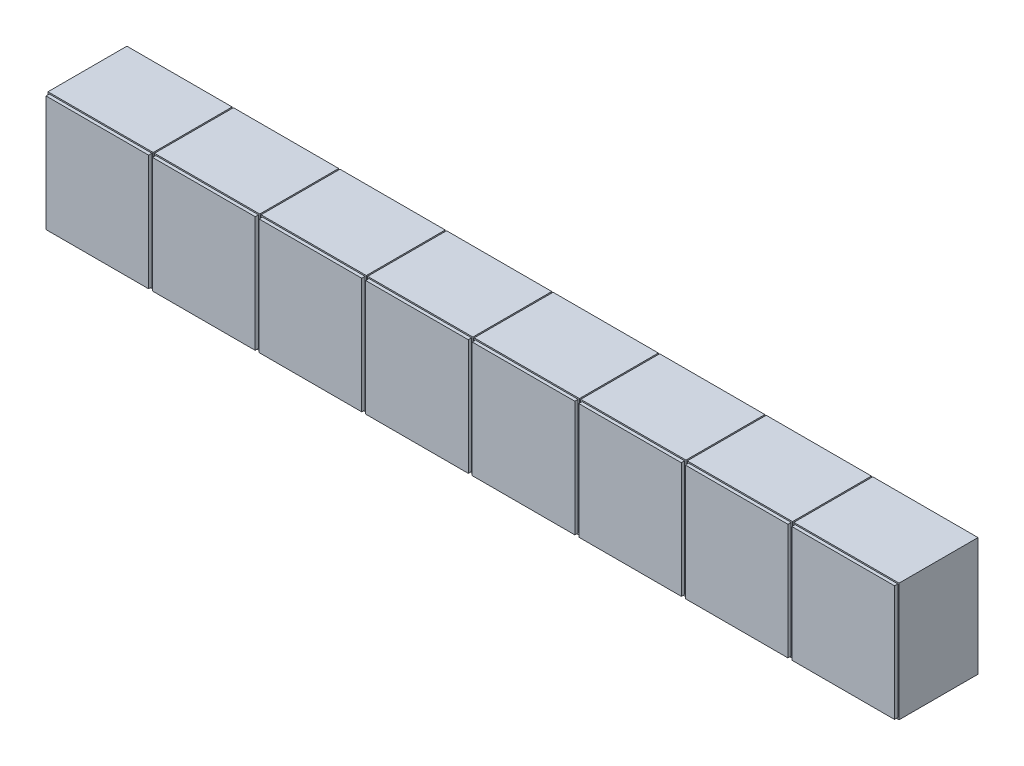
from build123d import *

# Parameters (mm, degrees)
SKETCH5_W           = 800
SKETCH5_H           = 900
BOSS_EXTRUDE7_DEPTH = 600
SKETCH6_W           = 760
SKETCH6_H           = 860
CUT_EXTRUDE3_DEPTH  = 100
SKETCH10_W          = 780
SKETCH10_H          = 880
BOSS_EXTRUDE8_DEPTH = 25


with BuildPart() as part:
    # Sketch5 → Boss-Extrude7 (new body)
    with BuildSketch(Plane.XY):
        with Locations((70.705071793, 182.298806907)):
            Rectangle(SKETCH5_W, SKETCH5_H)
    extrude(amount=BOSS_EXTRUDE7_DEPTH)

    # Sketch6 → Cut-Extrude3 (cut)
    with BuildSketch(Plane.XY.offset(600)):
        with Locations((70.705071793, 182.298806907)):
            Rectangle(SKETCH6_W, SKETCH6_H)
    extrude(amount=-CUT_EXTRUDE3_DEPTH, mode=Mode.SUBTRACT)

    # Sketch10 → Boss-Extrude8 (add)
    with BuildSketch(Plane.XY.offset(600)):
        with Locations((70.705071793, 182.298806907)):
            Rectangle(SKETCH10_W, SKETCH10_H)
    extrude(amount=BOSS_EXTRUDE8_DEPTH)


with BuildPart() as body_2:
    # Body-Move/Copy2: read off the stored shape, not the designer's step
    # Body-Move/Copy2: copy of part
    add(part.part.moved(Location((5670, 0, 0))))


with BuildPart() as body_3:
    # Body-Move_Copy2 2: copy of part
    add(part.part.moved(Location((4860, 0, 0))))


with BuildPart() as body_4:
    # Body-Move_Copy2 3: copy of part
    add(part.part.moved(Location((4050, 0, 0))))


with BuildPart() as body_5:
    # Body-Move_Copy2 4: copy of part
    add(part.part.moved(Location((3240, 0, 0))))


with BuildPart() as body_6:
    # Body-Move_Copy2 5: copy of part
    add(part.part.moved(Location((2430, 0, 0))))


with BuildPart() as body_7:
    # Body-Move_Copy2 6: copy of part
    add(part.part.moved(Location((1620, 0, 0))))


with BuildPart() as body_8:
    # Body-Move_Copy2 7: copy of part
    add(part.part.moved(Location((810, 0, 0))))


with BuildPart() as body_9:
    # Body-Move_Copy2 8: copy of part
    add(part.part.moved(Location((7290, 0, 0))))


with BuildPart() as body_10:
    # Body-Move_Copy2 9: copy of part
    add(part.part.moved(Location((6480, 0, 0))))


solid = Compound([part.part, body_2.part, body_3.part, body_4.part, body_5.part, body_6.part, body_7.part, body_8.part])
